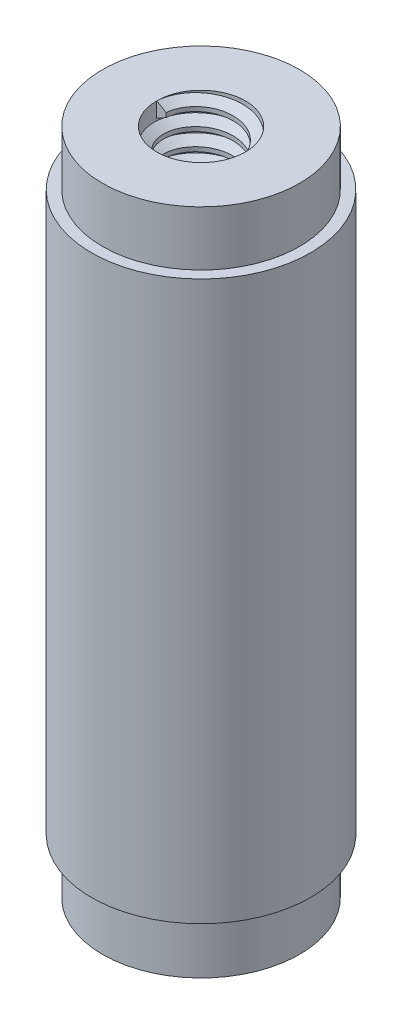
from build123d import *
from build123d.topology import SkipClean

# Parameters (mm, degrees)
SKETCH1_R           = 5
BOSS_EXTRUDE1_DEPTH = 30.5
SKETCH5_R           = 2.025
CUT_EXTRUDE1_DEPTH  = 12.7
THREAD1_PITCH       = 0.79375
CUT_EXTRUDE2_START  = -12.7
SKETCH19_R          = 2.025
CUT_EXTRUDE2_DEPTH  = 12.7
THREAD2_PITCH       = 0.79375
SKETCH24_R          = 5
SKETCH24_R_2        = 4.5
CUT_EXTRUDE3_DEPTH  = 2.5
CUT_EXTRUDE4_START  = -2.5
SKETCH25_R          = 5
SKETCH25_R_2        = 4.5
CUT_EXTRUDE4_DEPTH  = 2.5


with BuildPart() as part:
    # Sketch1 → Boss-Extrude1 (new body)
    with BuildSketch(Plane(origin=(0, 0, 0), x_dir=(1, 0, 0), z_dir=(0, 1, 0))):
        with Locations(Location((0, 0, 0), (0, 0, 90))):
            Circle(SKETCH1_R)
    extrude(amount=BOSS_EXTRUDE1_DEPTH)

    # Sketch5 → Cut-Extrude1 (cut)
    with BuildSketch(Plane.XZ):
        with Locations(Location((0, 0, 0), (0, 0, 270))):
            Circle(SKETCH5_R)
    extrude(amount=-CUT_EXTRUDE1_DEPTH, mode=Mode.SUBTRACT)

    # Thread1: the profile of Thread Profile3 profile screwed along a right-hand helix of 24 turns, 8 arcs to a turn; built about Z, then put on its axis
    thread1_z = Axis((0, 0, 0), (0, 0, 1))
    thread1_corners = [(2.0253, 0, -0.000173205), (2.0253, 0, 0.694704453), (1.595370212, 0, 0.446484374), (1.595370212, 0, 0.248046874)]
    with BuildLine(mode=Mode.PRIVATE) as thread1_profile:
        Line(thread1_corners[0], thread1_corners[1])
        Line(thread1_corners[1], thread1_corners[2])
        Line(thread1_corners[2], thread1_corners[3])
        Line(thread1_corners[3], thread1_corners[0])
    thread1_cap = Face(thread1_profile.wire())
    thread1_turn_angles = [0, 22.5, 45, 67.5, 90, 112.5, 135, 157.5, 180, 202.5, 225, 247.5, 270, 292.5, 315, 337.5, 360]
    thread1_turn_weights = [1, 0.9238795325112867, 1, 0.9238795325112867, 1, 0.9238795325112867, 1, 0.9238795325112867, 1, 0.9238795325112867, 1, 0.9238795325112867, 1, 0.9238795325112867, 1, 0.9238795325112867, 1]
    thread1_turn_rails = [Edge.make_bspline([Vector(p[0], p[1], 0).rotate(thread1_z, thread1_turn_angles[k]) / thread1_turn_weights[k] + Vector(0, 0, p[2] + THREAD1_PITCH * thread1_turn_angles[k] / 360) for k in range(17)], [0, 0, 0, 1, 1, 2, 2, 3, 3, 4, 4, 5, 5, 6, 6, 7, 7, 8, 8, 8], 2, thread1_turn_weights) for p in thread1_corners]
    thread1_turn_sides = [Face.make_surface_from_curves(thread1_turn_rails[p[0]], thread1_turn_rails[p[1]]) for p in [(0, 1), (1, 2), (2, 3), (3, 0)]]
    thread1 = Plane(origin=(0, 0, 0), x_dir=(1, 0, 0), z_dir=(0, 1, 0)) * Solid(Shell([*[p.moved(Location((0, 0, THREAD1_PITCH * i))) for i in range(24) for p in thread1_turn_sides], thread1_cap, thread1_cap.rotate(thread1_z, 8640).moved(Location((0, 0, THREAD1_PITCH * 8640 / 360)))]))
    add(thread1)

    # Sketch19 → Cut-Extrude2 (cut)
    with BuildSketch(Plane(origin=(0, 30.5, 0), x_dir=(1, 0, 0), z_dir=(0, 1, 0)).offset(CUT_EXTRUDE2_START)):
        with Locations(Location((0, 0, 0), (0, 0, 270))):
            Circle(SKETCH19_R)
    extrude(amount=CUT_EXTRUDE2_DEPTH, mode=Mode.SUBTRACT)

    # Thread2: the profile of Thread Profile4 profile screwed along a right-hand helix of 24 turns, 8 arcs to a turn; built about Z, then put on its axis
    thread2_z = Axis((0, 0, 0), (0, 0, 1))
    thread2_corners = [(2.0253, 0, -0.000173205), (2.0253, 0, 0.694704453), (1.595370212, 0, 0.446484374), (1.595370212, 0, 0.248046874)]
    with BuildLine(mode=Mode.PRIVATE) as thread2_profile:
        Line(thread2_corners[0], thread2_corners[1])
        Line(thread2_corners[1], thread2_corners[2])
        Line(thread2_corners[2], thread2_corners[3])
        Line(thread2_corners[3], thread2_corners[0])
    thread2_cap = Face(thread2_profile.wire())
    thread2_turn_angles = [0, 22.5, 45, 67.5, 90, 112.5, 135, 157.5, 180, 202.5, 225, 247.5, 270, 292.5, 315, 337.5, 360]
    thread2_turn_weights = [1, 0.9238795325112867, 1, 0.9238795325112867, 1, 0.9238795325112867, 1, 0.9238795325112867, 1, 0.9238795325112867, 1, 0.9238795325112867, 1, 0.9238795325112867, 1, 0.9238795325112867, 1]
    thread2_turn_rails = [Edge.make_bspline([Vector(p[0], p[1], 0).rotate(thread2_z, thread2_turn_angles[k]) / thread2_turn_weights[k] + Vector(0, 0, p[2] + THREAD2_PITCH * thread2_turn_angles[k] / 360) for k in range(17)], [0, 0, 0, 1, 1, 2, 2, 3, 3, 4, 4, 5, 5, 6, 6, 7, 7, 8, 8, 8], 2, thread2_turn_weights) for p in thread2_corners]
    thread2_turn_sides = [Face.make_surface_from_curves(thread2_turn_rails[p[0]], thread2_turn_rails[p[1]]) for p in [(0, 1), (1, 2), (2, 3), (3, 0)]]
    thread2 = Plane(origin=(0, 30.5, 0), x_dir=(-1, 0, 0), z_dir=(0, -1, 0)) * Solid(Shell([*[p.moved(Location((0, 0, THREAD2_PITCH * i))) for i in range(24) for p in thread2_turn_sides], thread2_cap, thread2_cap.rotate(thread2_z, 8640).moved(Location((0, 0, THREAD2_PITCH * 8640 / 360)))]))
    add(thread2)

    # Sketch24 → Cut-Extrude3 (cut)
    with SkipClean():  # the faces are left unmerged after this step: merging them gives an invalid solid
        with BuildSketch(Plane(origin=(0, 0, 0), x_dir=(-1, 0, 0), z_dir=(0, -1, 0))):
            with Locations(Location((0, 0, 0), (0, 0, 90))):
                Circle(SKETCH24_R)
            with Locations(Location((0, 0, 0), (0, 0, 90))):
                Circle(SKETCH24_R_2, mode=Mode.SUBTRACT)
        extrude(amount=-CUT_EXTRUDE3_DEPTH, mode=Mode.SUBTRACT)

    # Sketch25 → Cut-Extrude4 (cut)
    with SkipClean():  # the faces are left unmerged after this step: merging them gives an invalid solid
        with BuildSketch(Plane(origin=(0, 30.5, 0), x_dir=(1, 0, 0), z_dir=(0, 1, 0)).offset(CUT_EXTRUDE4_START)):
            with Locations(Location((0, 0, 0), (0, 0, 90))):
                Circle(SKETCH25_R)
            with Locations(Location((0, 0, 0), (0, 0, 90))):
                Circle(SKETCH25_R_2, mode=Mode.SUBTRACT)
        extrude(amount=CUT_EXTRUDE4_DEPTH, mode=Mode.SUBTRACT)


solid = part.part
